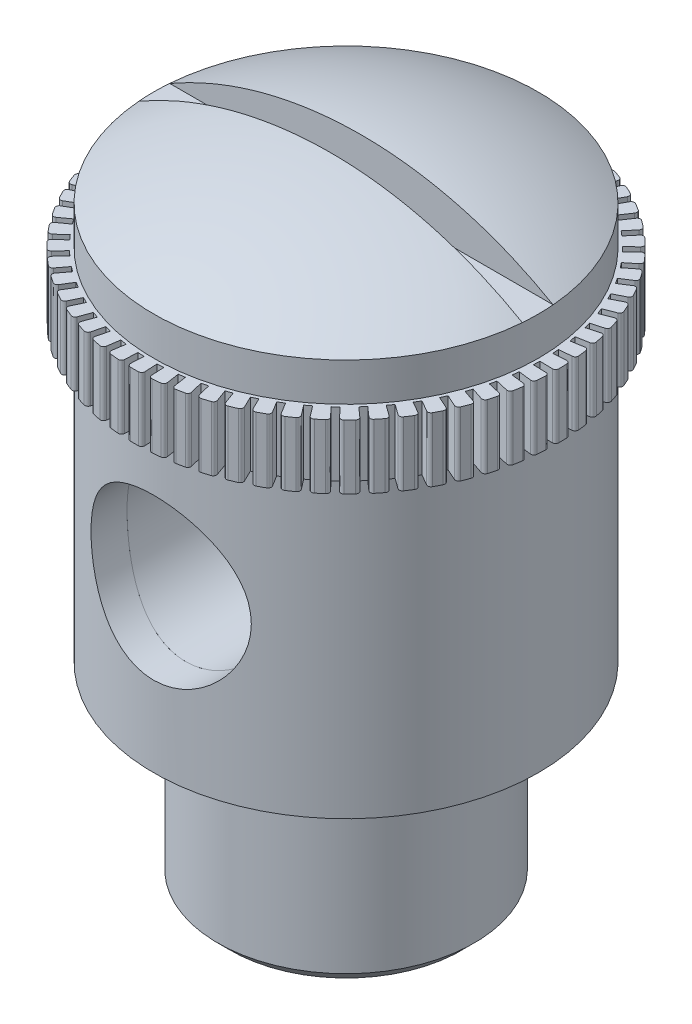
from build123d import *

# Parameters (mm, degrees)
SKETCH_4_R                       = 2.5
CUT_EXTRUDE_1_DEPTH              = 15.426364753
SKETCH_5_W                       = 0.2
SKETCH_5_H                       = 0.5
CUT_EXTRUDE_3_DEPTH              = 15.42636483
FILLET_1_R                       = 0.1
PATTERN_CIRCULAR_1_COUNT         = 63
FILLET_1_OF_PATTERN_CIRCULAR_1_R = 0.1
CUT_EXTRUDE_4_DEPTH              = 15.426314106
CUT_EXTRUDE_4_DEPTH_BACK         = 15.426314106
SKETCH_6_W                       = 0.96
SKETCH_6_H                       = 1.607695155


with BuildPart() as part:
    # 草图2 → 旋转1 (revolve)
    with BuildSketch(Plane.XY):
        with BuildLine():
            Line((-6, 6.196152423), (-6, 7.392304845))
            ThreePointArc((-6, 7.392304845), (-3.105828541, 8.591109915), (0, 9))
            Line((0, 9), (0, 5))
            Line((0, 5), (-1.5, 4.133974596))
            Line((-1.5, 4.133974596), (-1.5, -11))
            Line((-1.5, -11), (-3.6, -11))
            Line((-3.6, -11), (-4, -10.6))
            Line((-4, -10.6), (-4, -5.9))
            Line((-4, -5.9), (-3.2, -5.9))
            Line((-3.2, -5.9), (-3.2, -5))
            Line((-3.2, -5), (-5, -5))
            Line((-5, -5), (-5, 5))
            Line((-5, 5), (-4, 5))
            Line((-4, 5), (-4, 6.196152423))
            Line((-4, 6.196152423), (-6, 6.196152423))
        make_face()
    revolve(axis=Axis((0, 9, 0), (0, -1, 0)))


with BuildPart() as body_2:
    # 草图3 → 旋转2 (revolve)
    with BuildSketch(Plane.XY):
        Polygon((-5, 6.196152423), (-5, -5), (-6, -5), (-6, 4.196152423), (-6.6, 4.196152423), (-6.6, 6.196152423), align=None)
    revolve(axis=Axis((0, 9, 0), (0, -1, 0)))


with BuildPart() as cut_extrude_1_tool:
    # 草图4 → 切除-拉伸1 (new, through all)
    with BuildSketch(Plane.XY):
        Circle(SKETCH_4_R)
    extrude(amount=CUT_EXTRUDE_1_DEPTH)


with BuildPart() as part_1:
    add(part.part)

    # 切除-拉伸1: cut by cut_extrude_1_tool
    add(cut_extrude_1_tool.part, mode=Mode.SUBTRACT)

    # 草图6 → 切除-拉伸4 (cut, two sides: drawn at the far end of the back side and taken through both)
    with BuildSketch(Plane(origin=(0, 0, 0), x_dir=(0, 0, -1), z_dir=(1, 0, 0)).offset(-CUT_EXTRUDE_4_DEPTH_BACK)):
        with Locations((0, 8.196152423)):
            Rectangle(SKETCH_6_W, SKETCH_6_H)
    extrude(amount=CUT_EXTRUDE_4_DEPTH + CUT_EXTRUDE_4_DEPTH_BACK, mode=Mode.SUBTRACT)


with BuildPart() as body_2_1:
    add(body_2.part)

    # 切除-拉伸1: cut by cut_extrude_1_tool
    add(cut_extrude_1_tool.part, mode=Mode.SUBTRACT)

    # 草图5 → 切除-拉伸3 (cut, through all)
    with BuildSketch(Plane(origin=(0, 0, 0), x_dir=(1, 0, 0), z_dir=(0, 1, 0))):
        with Locations((0, 6.35)):
            Rectangle(SKETCH_5_W, SKETCH_5_H)
    cut_extrude_3 = extrude(amount=CUT_EXTRUDE_3_DEPTH, mode=Mode.SUBTRACT)

    # 圆角1
    fillet_1_edges = [body_2_1.edges().sort_by_distance(p)[0] for p in [
        (0.1, 5.196152423, -6.599242381),
        (-0.1, 5.196152423, -6.599242381),
    ]]
    fillet(fillet_1_edges, radius=FILLET_1_R)

    # 阵列(圆周)1: 切除-拉伸3 ×63 about axis
    pattern_circular_1_axis = Axis((0, 0, 0), (0, 1, 0))
    for i in range(1, PATTERN_CIRCULAR_1_COUNT):
        add(cut_extrude_3.rotate(pattern_circular_1_axis, i * 360 / PATTERN_CIRCULAR_1_COUNT), mode=Mode.SUBTRACT)

    # 圆角1 of 阵列(圆周)1
    fillet_1_of_pattern_circular_1_edges = [body_2_1.edges().sort_by_distance(p)[0] for p in [
        (-0.557569275, 5.196152423, -6.576406048),
        (-0.756575431, 5.196152423, -6.556492478),
        (-1.209597177, 5.196152423, -6.488210437),
        (-1.405631675, 5.196152423, -6.448581208),
        (-1.849603558, 5.196152423, -6.335532075),
        (-2.040718119, 5.196152423, -6.27658104),
        (-2.471227749, 5.196152423, -6.11988835),
        (-2.655522991, 5.196152423, -6.042201391),
        (-3.068291767, 5.196152423, -5.843422425),
        (-3.243936082, 5.196152423, -5.747771629),
        (-3.634861724, 5.196152423, -5.508881942),
        (-3.800109479, 5.196152423, -5.39621793),
        (-4.165306791, 5.196152423, -5.119591716),
        (-4.31851568, 5.196152423, -4.991034194),
        (-4.654355169, 5.196152423, -4.679420687),
        (-4.794002532, 5.196152423, -4.536247317),
        (-5.097146474, 5.196152423, -4.192743473),
        (-5.221844434, 5.196152423, -4.036377176),
        (-5.489280047, 5.196152423, -3.66439689),
        (-5.597789299, 5.196152423, -3.496391706),
        (-5.826858688, 5.196152423, -3.099631885),
        (-5.91810082, 5.196152423, -2.921657524),
        (-6.106527391, 5.196152423, -2.504061346),
        (-6.179595596, 5.196152423, -2.317886597),
        (-6.32550668, 5.196152423, -1.88360432),
        (-6.379674774, 5.196152423, -1.691079471),
        (-6.481620243, 5.196152423, -1.244427189),
        (-6.516349878, 5.196152423, -1.047465638),
        (-6.573316551, 5.196152423, -0.59288238),
        (-6.58826257, 5.196152423, -0.393441621),
        (-6.599684287, 5.196152423, 0.064554759),
        (-6.594698148, 5.196152423, 0.264492596),
        (-6.560461395, 5.196152423, 0.721350325),
        (-6.535592654, 5.196152423, 0.919798166),
        (-6.45603769, 5.196152423, 1.370976787),
        (-6.411533503, 5.196152423, 1.565962369),
        (-6.287450982, 5.196152423, 2.006977865),
        (-6.223753652, 5.196152423, 2.196563335),
        (-6.056376761, 5.196152423, 2.623032696),
        (-5.974119341, 5.196152423, 2.805333867),
        (-5.765111547, 5.196152423, 3.21301865),
        (-5.665111547, 5.196152423, 3.386223731),
        (-5.416550065, 5.196152423, 3.771072181),
        (-5.299801331, 5.196152423, 3.933459782),
        (-5.014156475, 5.196152423, 4.291647102),
        (-4.881819307, 5.196152423, 4.441603343),
        (-4.561929945, 5.196152423, 4.769569706),
        (-4.41531957, 5.196152423, 4.905604254),
        (-4.064364905, 5.196152423, 5.200090184),
        (-3.904938404, 5.196152423, 5.320851066),
        (-3.526406381, 5.196152423, 5.578929829),
        (-3.355748205, 5.196152423, 5.68321687),
        (-2.953400846, 5.196152423, 5.902323563),
        (-2.773207073, 5.196152423, 5.989100311),
        (-2.351043087, 5.196152423, 6.167057354),
        (-2.163104563, 5.196152423, 6.235461382),
        (-1.725319605, 5.196152423, 6.370500158),
        (-1.531504148, 5.196152423, 6.419851637),
        (-1.082449122, 5.196152423, 6.510630069),
        (-0.884682957, 5.196152423, 6.540438522),
        (-0.428820773, 5.196152423, 6.586054414),
        (-0.229069389, 5.196152423, 6.596023591),
        (0.229069389, 5.196152423, 6.596023591),
        (0.428820773, 5.196152423, 6.586054414),
        (0.884682957, 5.196152423, 6.540438522),
        (1.082449122, 5.196152423, 6.510630069),
        (1.531504148, 5.196152423, 6.419851637),
        (1.725319605, 5.196152423, 6.370500158),
        (2.163104563, 5.196152423, 6.235461382),
        (2.351043087, 5.196152423, 6.167057354),
        (2.773207073, 5.196152423, 5.989100311),
        (2.953400846, 5.196152423, 5.902323563),
        (3.355748205, 5.196152423, 5.68321687),
        (3.526406381, 5.196152423, 5.578929829),
        (3.904938404, 5.196152423, 5.320851066),
        (4.064364905, 5.196152423, 5.200090184),
        (4.41531957, 5.196152423, 4.905604254),
        (4.561929945, 5.196152423, 4.769569706),
        (4.881819307, 5.196152423, 4.441603343),
        (5.014156475, 5.196152423, 4.291647102),
        (5.299801331, 5.196152423, 3.933459782),
        (5.416550065, 5.196152423, 3.771072181),
        (5.665111547, 5.196152423, 3.386223731),
        (5.765111547, 5.196152423, 3.21301865),
        (5.974119341, 5.196152423, 2.805333867),
        (6.056376761, 5.196152423, 2.623032696),
        (6.223753652, 5.196152423, 2.196563335),
        (6.287450982, 5.196152423, 2.006977865),
        (6.411533503, 5.196152423, 1.565962369),
        (6.45603769, 5.196152423, 1.370976787),
        (6.535592654, 5.196152423, 0.919798166),
        (6.560461395, 5.196152423, 0.721350325),
        (6.594698148, 5.196152423, 0.264492596),
        (6.599684287, 5.196152423, 0.064554759),
        (6.58826257, 5.196152423, -0.393441621),
        (6.573316551, 5.196152423, -0.59288238),
        (6.516349878, 5.196152423, -1.047465638),
        (6.481620243, 5.196152423, -1.244427189),
        (6.379674774, 5.196152423, -1.691079471),
        (6.32550668, 5.196152423, -1.88360432),
        (6.179595596, 5.196152423, -2.317886597),
        (6.106527391, 5.196152423, -2.504061346),
        (5.91810082, 5.196152423, -2.921657524),
        (5.826858688, 5.196152423, -3.099631885),
        (5.597789299, 5.196152423, -3.496391706),
        (5.489280047, 5.196152423, -3.66439689),
        (5.221844434, 5.196152423, -4.036377176),
        (5.097146474, 5.196152423, -4.192743473),
        (4.794002532, 5.196152423, -4.536247317),
        (4.654355169, 5.196152423, -4.679420687),
        (4.31851568, 5.196152423, -4.991034194),
        (4.165306791, 5.196152423, -5.119591716),
        (3.800109479, 5.196152423, -5.39621793),
        (3.634861724, 5.196152423, -5.508881942),
        (3.243936082, 5.196152423, -5.747771629),
        (3.068291767, 5.196152423, -5.843422425),
        (2.655522991, 5.196152423, -6.042201391),
        (2.471227749, 5.196152423, -6.11988835),
        (2.040718119, 5.196152423, -6.27658104),
        (1.849603558, 5.196152423, -6.335532075),
        (1.405631675, 5.196152423, -6.448581208),
        (1.209597177, 5.196152423, -6.488210437),
        (0.756575431, 5.196152423, -6.556492478),
        (0.557569275, 5.196152423, -6.576406048),
    ]]
    fillet(fillet_1_of_pattern_circular_1_edges, radius=FILLET_1_OF_PATTERN_CIRCULAR_1_R)


solid = Compound([part_1.part, body_2_1.part])
